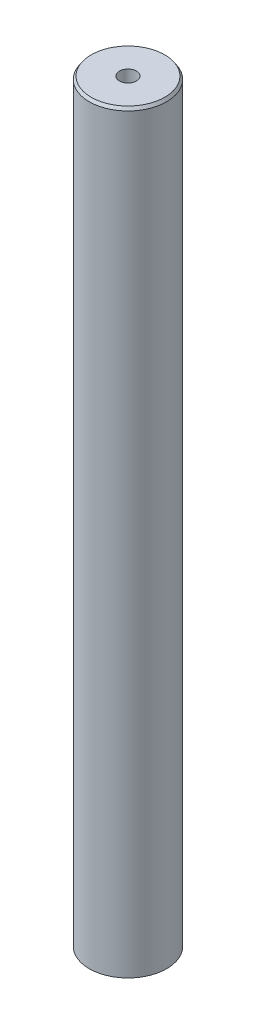
from build123d import *
from OCP.BRepFilletAPI import BRepFilletAPI_MakeChamfer

# Parameters (mm, degrees)
SKETCH1_R           = 5
BOSS_EXTRUDE1_DEPTH = 97.632048882
SKETCH2_R           = 1.107615153
CUT_EXTRUDE1_DEPTH  = 98.887777423
CHAMFER1_SIZE       = 0.378567816
CHAMFER1_SIZE2      = 0.24842029


with BuildPart() as part:
    # Sketch1 → Boss-Extrude1 (new body)
    with BuildSketch(Plane(origin=(0, 0, 0), x_dir=(1, 0, 0), z_dir=(0, 1, 0))):
        Circle(SKETCH1_R)
    extrude(amount=BOSS_EXTRUDE1_DEPTH)

    # Sketch2 → Cut-Extrude1 (cut, through all)
    with BuildSketch(Plane(origin=(0, 0, 0), x_dir=(1, 0, 0), z_dir=(0, 1, 0))):
        Circle(SKETCH2_R)
    extrude(amount=CUT_EXTRUDE1_DEPTH, mode=Mode.SUBTRACT)

    # Chamfer1: one chamfer whose edges measure the first distance from different faces: ONE call of the kernel's chamfer builder (chamfer() names one face for all edges)
    chamfer1_edges_1 = [part.edges().sort_by_distance(p)[0] for p in [
        (-5, 97.632048882, 0),
    ]]
    chamfer1_side_1 = [part.faces().sort_by_distance(p)[0] for p in [
        (-5, 48.816024441, 0),
    ]]
    chamfer1_edges_2 = [part.edges().sort_by_distance(p)[0] for p in [
        (-5, 0, 0),
    ]]
    chamfer1_side_2 = [part.faces().sort_by_distance(p)[0] for p in [
        (-4.858578644, 0, 0),
    ]]
    chamfer1 = BRepFilletAPI_MakeChamfer(part.part.solid().wrapped)
    for e in chamfer1_edges_1:
        chamfer1.Add(CHAMFER1_SIZE, CHAMFER1_SIZE2, e.wrapped, chamfer1_side_1[0].wrapped)  # the first distance lies on this face
    for e in chamfer1_edges_2:
        chamfer1.Add(CHAMFER1_SIZE, CHAMFER1_SIZE2, e.wrapped, chamfer1_side_2[0].wrapped)  # the first distance lies on this face
    add(Compound.cast(chamfer1.Shape()), mode=Mode.REPLACE)


solid = part.part
